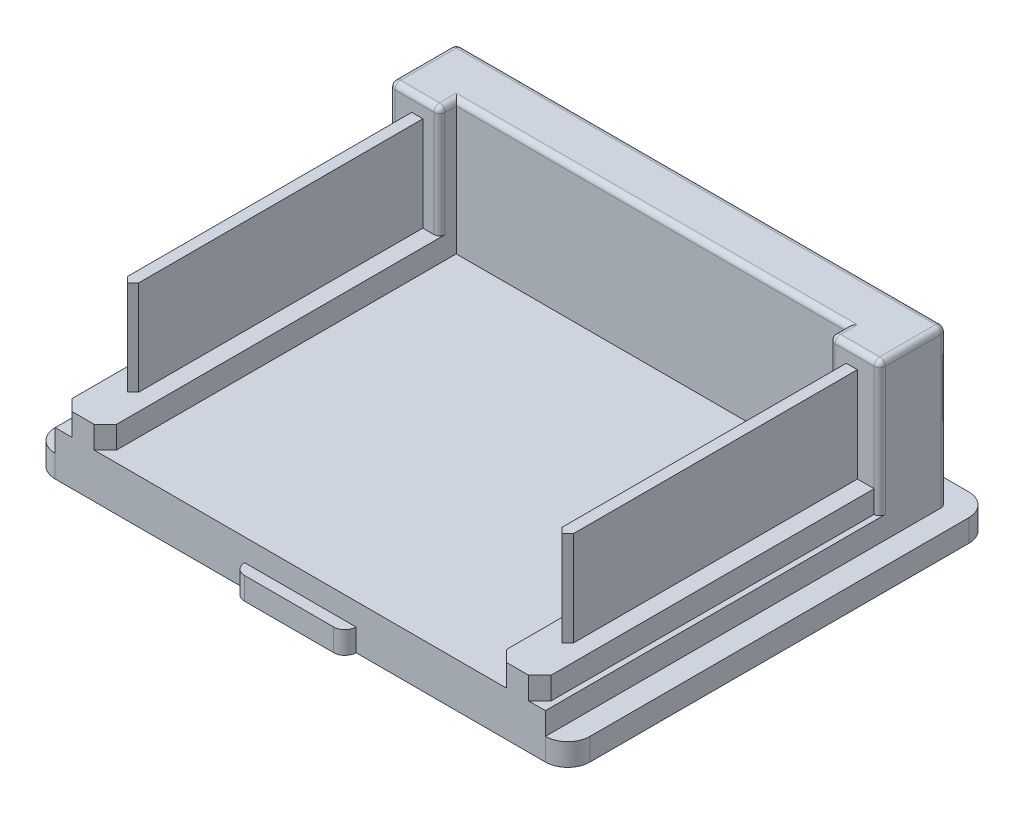
from build123d import *

# Parameters (mm, degrees)
SKETCH1_W                = 48
SKETCH1_H                = 38
BOSS_EXTRUDE1_DEPTH      = 2
SKETCH2_W                = 44
SKETCH2_H                = 36
BOSS_EXTRUDE2_DEPTH      = 2
SKETCH3_W                = 4
SKETCH3_H                = 30
BOSS_EXTRUDE3_DEPTH      = 2
CHAMFER1_SIZE            = 1
BOSS_EXTRUDE4_DEPTH      = 12
FILLET1_R                = 0.5
SKETCH5_W                = 1
SKETCH5_H                = 26
BOSS_EXTRUDE5_DEPTH      = 8.5
CHAMFER2_SIZE            = 0.5
CHAMFER2_OF_MIRROR1_SIZE = 0.5
SKETCH6_W                = 10
SKETCH6_H                = 1
BOSS_EXTRUDE6_DEPTH      = 2
FILLET2_R                = 1
SKETCH7_W                = 0.95
SKETCH7_H                = 1.9
SKETCH7_H_2              = 11.2
BOSS_EXTRUDE7_DEPTH      = 4.5
SKETCH8_W                = 1.9
SKETCH8_H                = 11.2
BOSS_EXTRUDE8_DEPTH      = 4
SKETCH9_W                = 1
SKETCH9_H                = 6.5
BOSS_EXTRUDE9_DEPTH      = 9
FILLET3_R                = 1
SKETCH10_R               = 0.75
CUT_EXTRUDE1_DEPTH       = 2
FILLET3_OF_MIRROR2_R     = 1
CUT_EXTRUDE2_DEPTH       = 2
FILLET4_R                = 1
FILLET5_R                = 2


with BuildPart() as part:
    # Sketch1 → Boss-Extrude1 (new body)
    with BuildSketch(Plane(origin=(0, 0, 0), x_dir=(1, 0, 0), z_dir=(0, 1, 0))):
        Rectangle(SKETCH1_W, SKETCH1_H)
    extrude(amount=BOSS_EXTRUDE1_DEPTH)

    # Sketch2 → Boss-Extrude2 (add)
    with BuildSketch(Plane(origin=(0, 2, 0), x_dir=(1, 0, 0), z_dir=(0, 1, 0))):
        with Locations((0, -1)):
            Rectangle(SKETCH2_W, SKETCH2_H)
    extrude(amount=BOSS_EXTRUDE2_DEPTH)

    # Sketch3 → Boss-Extrude3 (add)
    with BuildSketch(Plane(origin=(0, 4, 0), x_dir=(1, 0, 0), z_dir=(0, 1, 0))):
        with Locations((-19.5, -4)):
            Rectangle(SKETCH3_W, SKETCH3_H)
        with Locations((19.5, -4)):
            Rectangle(SKETCH3_W, SKETCH3_H)
    extrude(amount=BOSS_EXTRUDE3_DEPTH)

    # Chamfer1
    chamfer1_edges = [part.edges().sort_by_distance(p)[0] for p in [
        (-21.5, 5, 19),
        (-17.5, 5, 19),
        (17.5, 5, 19),
        (21.5, 5, 19),
    ]]
    chamfer(chamfer1_edges, length=CHAMFER1_SIZE)

    # Sketch4 → Boss-Extrude4 (add)
    with BuildSketch(Plane(origin=(0, 4, 0), x_dir=(1, 0, 0), z_dir=(0, 1, 0))):
        Polygon((22, 17), (-22, 17), (-22, 11), (-21.5, 11), (-17.5, 11), (-17.5, 12.5), (17.5, 12.5), (17.5, 11), (21.5, 11), (22, 11), align=None)
    extrude(amount=BOSS_EXTRUDE4_DEPTH)

    # Fillet1
    fillet1_edges = [part.edges().sort_by_distance(p)[0] for p in [
        (17.5, 11, -11),
        (17.5, 16, -11.75),
        (22, 10, -11),
        (-22, 10, -11),
        (-17.5, 11, -11),
        (19.75, 16, -11),
        (22, 16, -14),
        (0, 16, -17),
        (-22, 16, -14),
        (-19.75, 16, -11),
        (-17.5, 16, -11.75),
        (0, 16, -12.5),
        (-22, 9, -17),
        (22, 9, -17),
    ]]
    fillet(fillet1_edges, radius=FILLET1_R - 0.0001)  # a hair under: the kernel refuses the full size

    # Sketch5 → Boss-Extrude5 (add)
    with BuildSketch(Plane(origin=(0, 6, 0), x_dir=(1, 0, 0), z_dir=(0, 1, 0))):
        with Locations((-19.5, -2)):
            Rectangle(SKETCH5_W, SKETCH5_H)
    boss_extrude5 = extrude(amount=BOSS_EXTRUDE5_DEPTH)

    # Chamfer2
    chamfer2_edges = [part.edges().sort_by_distance(p)[0] for p in [
        (-19, 10.25, 15),
        (-20, 10.25, 15),
    ]]
    chamfer(chamfer2_edges, length=CHAMFER2_SIZE - 0.0001)  # a hair under: the kernel refuses the full size

    # Mirror1: Boss-Extrude5 across plane
    add(boss_extrude5.mirror(Plane.ZY))

    # Chamfer2 of Mirror1
    chamfer2_of_mirror1_edges = [part.edges().sort_by_distance(p)[0] for p in [
        (19, 10.25, 15),
        (20, 10.25, 15),
    ]]
    chamfer(chamfer2_of_mirror1_edges, length=CHAMFER2_OF_MIRROR1_SIZE - 0.0001)  # a hair under: the kernel refuses the full size

    # Sketch6 → Boss-Extrude6 (add)
    with BuildSketch(Plane.XZ):
        with Locations((0, 19.5)):
            Rectangle(SKETCH6_W, SKETCH6_H)
    extrude(amount=-BOSS_EXTRUDE6_DEPTH)

    # Fillet2
    fillet2_edges = [part.edges().sort_by_distance(p)[0] for p in [
        (-5, 1, 20),
        (5, 1, 20),
    ]]
    fillet(fillet2_edges, radius=FILLET2_R - 0.0001)  # a hair under: the kernel refuses the full size

    # Sketch7 → Boss-Extrude7 (add)
    with BuildSketch(Plane.XZ):
        Polygon((-10, -14), (-0.95, -14), (-0.95, -12.1), (-8.1, -12.1), (-8.1, -0.9), (-0.95, -0.9), (-0.95, 1), (-10, 1), align=None)
        with Locations((-0.475, -13.05)):
            Rectangle(SKETCH7_W, SKETCH7_H)
        with Locations((0.475, -13.05)):
            Rectangle(SKETCH7_W, SKETCH7_H)
        Polygon((0.95, -14), (10, -14), (10, 1), (0.95, 1), (0.95, -0.9), (8.1, -0.9), (8.1, -12.1), (0.95, -12.1), align=None)
        with Locations((-0.475, -6.5)):
            Rectangle(SKETCH7_W, SKETCH7_H_2)
        with Locations((0.475, -6.5)):
            Rectangle(SKETCH7_W, SKETCH7_H_2)
        with Locations((-0.475, 0.05)):
            Rectangle(SKETCH7_W, SKETCH7_H)
        with Locations((0.475, 0.05)):
            Rectangle(SKETCH7_W, SKETCH7_H)
    extrude(amount=BOSS_EXTRUDE7_DEPTH)

    # Sketch8 → Boss-Extrude8 (add)
    with BuildSketch(Plane.XZ.offset(4.5)):
        with Locations((0, -6.5)):
            Rectangle(SKETCH8_W, SKETCH8_H)
    extrude(amount=BOSS_EXTRUDE8_DEPTH)

    # Sketch9 → Boss-Extrude9 (add)
    with BuildSketch(Plane.XZ):
        with Locations((-4.525, -6.5)):
            Rectangle(SKETCH9_W, SKETCH9_H)
    boss_extrude9 = extrude(amount=BOSS_EXTRUDE9_DEPTH)

    # Fillet3
    fillet3_edges = [part.edges().sort_by_distance(p)[0] for p in [
        (-4.525, -9, -3.25),
        (-4.525, -9, -9.75),
    ]]
    fillet(fillet3_edges, radius=FILLET3_R)

    # Sketch10 → Cut-Extrude1 (cut)
    with BuildSketch(Plane.ZY.offset(5.025)):
        with Locations((-6.5, -6)):
            Circle(SKETCH10_R)
    cut_extrude1 = extrude(amount=-CUT_EXTRUDE1_DEPTH, mode=Mode.SUBTRACT)

    # Mirror2: Boss-Extrude9, Cut-Extrude1 across plane
    add(boss_extrude9.mirror(Plane.ZY))
    add(cut_extrude1.mirror(Plane.ZY), mode=Mode.SUBTRACT)

    # Fillet3 of Mirror2
    fillet3_of_mirror2_edges = [part.edges().sort_by_distance(p)[0] for p in [
        (4.525, -9, -3.25),
        (4.525, -9, -9.75),
    ]]
    fillet(fillet3_of_mirror2_edges, radius=FILLET3_OF_MIRROR2_R)

    # Sketch11 → Cut-Extrude2 (cut)
    with BuildSketch(Plane.XZ):
        Polygon((20, -11.4), (10, -11.4), (10, -14), (-10, -14), (-10, -11.4), (-20, -11.4), (-20, -15.2), (20, -15.2), align=None)
        Polygon((10, -1.9), (20, -1.9), (20, 17.1), (-20, 17.1), (-20, -1.9), (-10, -1.9), (-10, 1), (10, 1), align=None)
    extrude(amount=-CUT_EXTRUDE2_DEPTH, mode=Mode.SUBTRACT)

    # Fillet4
    fillet4_edges = [part.edges().sort_by_distance(p)[0] for p in [
        (0, -8.5, -12.1),
        (0, -8.5, -0.9),
    ]]
    fillet(fillet4_edges, radius=FILLET4_R)

    # Fillet5
    fillet5_edges = [part.edges().sort_by_distance(p)[0] for p in [
        (-24, 1, -19),
        (-24, 1, 19),
        (24, 1, 19),
        (24, 1, -19),
    ]]
    fillet(fillet5_edges, radius=FILLET5_R)


solid = part.part
